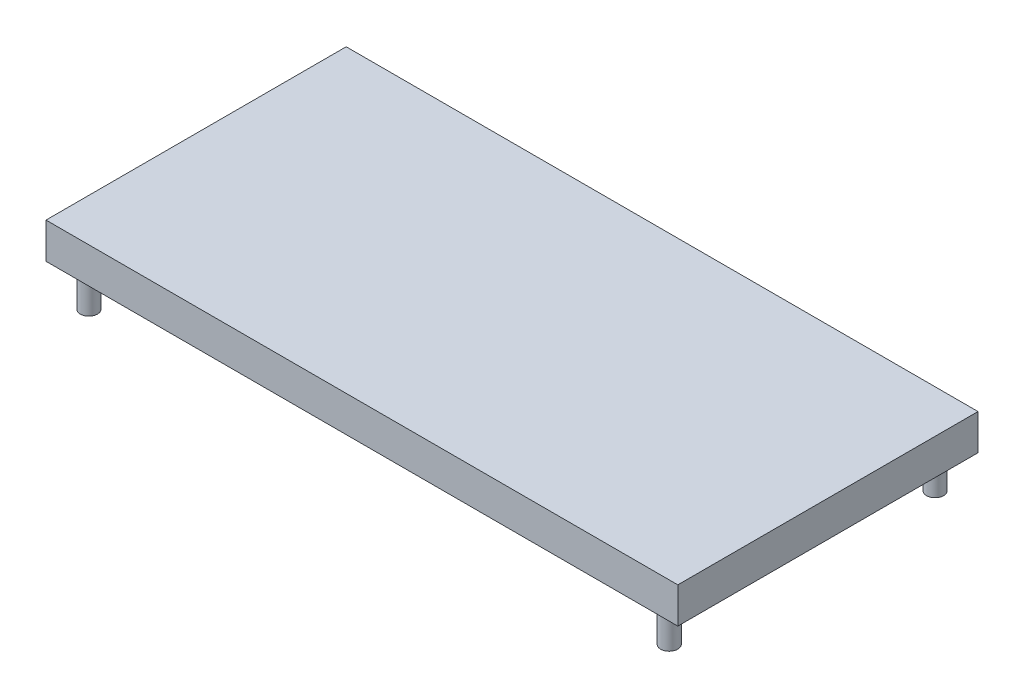
from build123d import *

# Parameters (mm, degrees)
SKETCH2_W             = 221
SKETCH2_H             = 105
BOSS_EXTRUDE1_DEPTH   = 2.5
SKETCH3_W             = 221
SKETCH3_H             = 105
SKETCH3_W_2           = 216
SKETCH3_H_2           = 100
BOSS_EXTRUDE2_DEPTH   = 10
SKETCH5_R             = 3
BOSS_EXTRUDE3_DEPTH   = 23
M3_TAPPED_HOLE1_D     = 2.5
M3_TAPPED_HOLE1_DEPTH = 10.1
M3_TAPPED_HOLE1_TIP   = 0.751075774


with BuildPart() as part:
    # Sketch2 → Boss-Extrude1 (new body)
    with BuildSketch(Plane(origin=(0, 0, 0), x_dir=(1, 0, 0), z_dir=(0, 1, 0))):
        Rectangle(SKETCH2_W, SKETCH2_H)
    extrude(amount=BOSS_EXTRUDE1_DEPTH)

    # Sketch3 → Boss-Extrude2 (add)
    with BuildSketch(Plane.XZ):
        Rectangle(SKETCH3_W, SKETCH3_H)
        Rectangle(SKETCH3_W_2, SKETCH3_H_2, mode=Mode.SUBTRACT)
    extrude(amount=BOSS_EXTRUDE2_DEPTH)

    # Sketch5 → Boss-Extrude3 (add)
    with BuildSketch(Plane.XZ):
        with Locations((101.5, -46.5)):
            Circle(SKETCH5_R)
        with Locations((-101.5, -46.5)):
            Circle(SKETCH5_R)
        with Locations((-101.5, 46.5)):
            Circle(SKETCH5_R)
        with Locations((101.5, 46.5)):
            Circle(SKETCH5_R)
    extrude(amount=BOSS_EXTRUDE3_DEPTH)

    # M3 Tapped Hole1
    with Locations(Plane(origin=(0, -23, 0), x_dir=(-1, 0, 0), z_dir=(0, -1, 0))):
        with Locations((-101.5, 46.5), (101.5, 46.5), (101.5, -46.5), (-101.5, -46.5)):
            Hole(M3_TAPPED_HOLE1_D / 2, depth=M3_TAPPED_HOLE1_DEPTH)
            with Locations((0, 0, -(M3_TAPPED_HOLE1_DEPTH + M3_TAPPED_HOLE1_TIP / 2))):  # 118° drill point
                Cone(0, M3_TAPPED_HOLE1_D / 2, M3_TAPPED_HOLE1_TIP, mode=Mode.SUBTRACT)


solid = part.part
